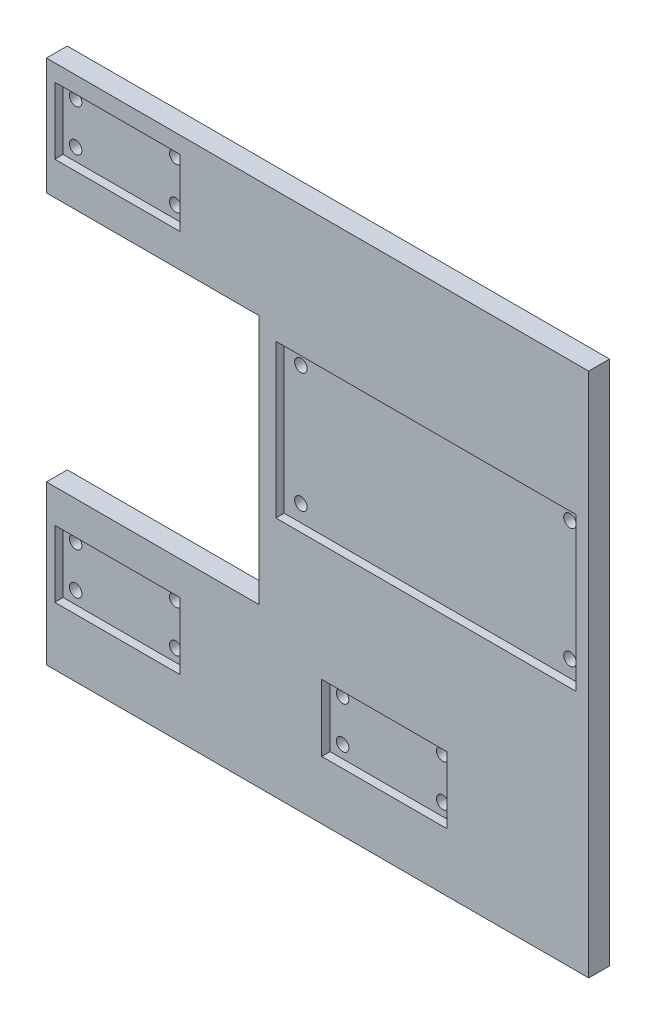
from build123d import *

# Parameters (mm, degrees)
EXTRUDE_2_DEPTH      = 5
CUT_EXTRUDE_1_DEPTH  = 2
CUT_EXTRUDE_2_REACH  = 155.704
SKETCH_4_R           = 1.55
CUT_EXTRUDE_3_REACH  = 155.756
SKETCH_5_W           = 32
SKETCH_5_H           = 56
SKETCH_7_W           = 40.5
SKETCH_7_H           = 40.5
EXTRUDE_4_DEPTH      = 2
CUT_EXTRUDE_4_DEPTH  = 2
SKETCH_9_R           = 1.55
CUT_EXTRUDE_6_DEPTH  = 154.727030805
SKETCH_10_W          = 60
SKETCH_10_H          = 45
EXTRUDE_5_DEPTH      = 2
SKETCH_11_W          = 60
SKETCH_11_H          = 45
CUT_EXTRUDE_8_DEPTH  = 2
SKETCH_12_W          = 30
SKETCH_12_H          = 16.1
SKETCH_12_W_2        = 30.5
SKETCH_12_H_2        = 16.5
EXTRUDE_6_DEPTH      = 5
SKETCH_13_R          = 1.5
CUT_EXTRUDE_10_DEPTH = 5
SKETCH_14_W          = 30
SKETCH_14_H          = 16
CUT_EXTRUDE_11_DEPTH = 2
SKETCH_15_W          = 53
SKETCH_15_H          = 60
SKETCH_15_W_2        = 49
SKETCH_15_H_2        = 56
CUT_EXTRUDE_12_DEPTH = 5
SKETCH_16_W          = 30
SKETCH_16_H          = 16
CUT_EXTRUDE_13_DEPTH = 2
SKETCH_17_R          = 1.5
CUT_EXTRUDE_15_DEPTH = 154.704261489
EXTRUDE_7_DEPTH      = 5
SKETCH_19_W          = 30
SKETCH_19_H          = 16
EXTRUDE_8_DEPTH      = 5
SKETCH_20_W          = 72
SKETCH_20_H          = 36.7
CUT_EXTRUDE_17_DEPTH = 2
SKETCH_21_R          = 1.5
CUT_EXTRUDE_18_DEPTH = 162.632298752
SKETCH_22_R          = 1.5
EXTRUDE_10_DEPTH     = 3
SKETCH_23_R          = 1.5
CUT_EXTRUDE_19_DEPTH = 162.632298752


with BuildPart() as part:
    # 草图1 → 凸台-拉伸2 (new body)
    with BuildSketch(Plane.XY):
        Polygon((0, 0), (0, 30), (120, 30), (120, -96), (0, -96), (0, -56), (45, -56), (45, 0), align=None)
    extrude(amount=EXTRUDE_2_DEPTH)

    # 草图3 → 切除-拉伸1 (cut)
    with BuildSketch(Plane.XY.offset(5)):
        Polygon((2, 10), (2, 1.95), (32, 1.95), (32, 18.05), (2, 18.05), align=None)
        Polygon((32, -74.05), (32, -57.95), (2, -57.95), (2, -66), (2, -74.05), align=None)
    extrude(amount=-CUT_EXTRUDE_1_DEPTH, mode=Mode.SUBTRACT)

    # 草图4 → 切除-拉伸2 (cut, up to next)
    with BuildSketch(Plane.XY.offset(3), mode=Mode.PRIVATE) as cut_extrude_2_sk1:
        with Locations((5, 15)):
            Circle(SKETCH_4_R)
    cut_extrude_2_tool1 = extrude(cut_extrude_2_sk1.sketch, amount=-CUT_EXTRUDE_2_REACH, mode=Mode.PRIVATE) & part.part
    # 草图4 → 切除-拉伸2 (cut, up to next)
    with BuildSketch(Plane.XY.offset(3), mode=Mode.PRIVATE) as cut_extrude_2_sk2:
        with Locations((29, 15)):
            Circle(SKETCH_4_R)
    cut_extrude_2_tool2 = extrude(cut_extrude_2_sk2.sketch, amount=-CUT_EXTRUDE_2_REACH, mode=Mode.PRIVATE) & part.part
    # 草图4 → 切除-拉伸2 (cut, up to next)
    with BuildSketch(Plane.XY.offset(3), mode=Mode.PRIVATE) as cut_extrude_2_sk3:
        with Locations((29, 5)):
            Circle(SKETCH_4_R)
    cut_extrude_2_tool3 = extrude(cut_extrude_2_sk3.sketch, amount=-CUT_EXTRUDE_2_REACH, mode=Mode.PRIVATE) & part.part
    # 草图4 → 切除-拉伸2 (cut, up to next)
    with BuildSketch(Plane.XY.offset(3), mode=Mode.PRIVATE) as cut_extrude_2_sk4:
        with Locations((5, 5)):
            Circle(SKETCH_4_R)
    cut_extrude_2_tool4 = extrude(cut_extrude_2_sk4.sketch, amount=-CUT_EXTRUDE_2_REACH, mode=Mode.PRIVATE) & part.part
    # 草图4 → 切除-拉伸2 (cut, up to next)
    with BuildSketch(Plane.XY.offset(3), mode=Mode.PRIVATE) as cut_extrude_2_sk5:
        with Locations((5, -61)):
            Circle(SKETCH_4_R)
    cut_extrude_2_tool5 = extrude(cut_extrude_2_sk5.sketch, amount=-CUT_EXTRUDE_2_REACH, mode=Mode.PRIVATE) & part.part
    # 草图4 → 切除-拉伸2 (cut, up to next)
    with BuildSketch(Plane.XY.offset(3), mode=Mode.PRIVATE) as cut_extrude_2_sk6:
        with Locations((29, -61)):
            Circle(SKETCH_4_R)
    cut_extrude_2_tool6 = extrude(cut_extrude_2_sk6.sketch, amount=-CUT_EXTRUDE_2_REACH, mode=Mode.PRIVATE) & part.part
    # 草图4 → 切除-拉伸2 (cut, up to next)
    with BuildSketch(Plane.XY.offset(3), mode=Mode.PRIVATE) as cut_extrude_2_sk7:
        with Locations((29, -71)):
            Circle(SKETCH_4_R)
    cut_extrude_2_tool7 = extrude(cut_extrude_2_sk7.sketch, amount=-CUT_EXTRUDE_2_REACH, mode=Mode.PRIVATE) & part.part
    # 草图4 → 切除-拉伸2 (cut, up to next)
    with BuildSketch(Plane.XY.offset(3), mode=Mode.PRIVATE) as cut_extrude_2_sk8:
        with Locations((5, -71)):
            Circle(SKETCH_4_R)
    cut_extrude_2_tool8 = extrude(cut_extrude_2_sk8.sketch, amount=-CUT_EXTRUDE_2_REACH, mode=Mode.PRIVATE) & part.part
    add(cut_extrude_2_tool1.solids().sort_by_distance((5, 15, 3))[0], mode=Mode.SUBTRACT)
    add(cut_extrude_2_tool2.solids().sort_by_distance((29, 15, 3))[0], mode=Mode.SUBTRACT)
    add(cut_extrude_2_tool3.solids().sort_by_distance((29, 5, 3))[0], mode=Mode.SUBTRACT)
    add(cut_extrude_2_tool4.solids().sort_by_distance((5, 5, 3))[0], mode=Mode.SUBTRACT)
    add(cut_extrude_2_tool5.solids().sort_by_distance((5, -61, 3))[0], mode=Mode.SUBTRACT)
    add(cut_extrude_2_tool6.solids().sort_by_distance((29, -61, 3))[0], mode=Mode.SUBTRACT)
    add(cut_extrude_2_tool7.solids().sort_by_distance((29, -71, 3))[0], mode=Mode.SUBTRACT)
    add(cut_extrude_2_tool8.solids().sort_by_distance((5, -71, 3))[0], mode=Mode.SUBTRACT)

    # 草图5 → 切除-拉伸3 (cut, up to next)
    with BuildSketch(Plane.XY.offset(5), mode=Mode.PRIVATE) as cut_extrude_3_sk1:
        with Locations((33, -28)):
            Rectangle(SKETCH_5_W, SKETCH_5_H)
    cut_extrude_3_tool1 = extrude(cut_extrude_3_sk1.sketch, amount=-CUT_EXTRUDE_3_REACH, mode=Mode.PRIVATE) & part.part
    add(cut_extrude_3_tool1.solids().sort_by_distance((33, -28, 5))[0], mode=Mode.SUBTRACT)

    # 草图7 → 凸台-拉伸4 (add)
    with BuildSketch(Plane.XY.offset(5)):
        with Locations((79.25, -35.75)):
            Rectangle(SKETCH_7_W, SKETCH_7_H)
    extrude(amount=EXTRUDE_4_DEPTH)

    # 草图8 → 切除-拉伸4 (cut)
    with BuildSketch(Plane.XY.offset(5)):
        Polygon((54.25, -62.25), (54.25, -78.75), (84.75, -78.75), (84.75, -62.25), (69.5, -62.25), align=None)
    extrude(amount=-CUT_EXTRUDE_4_DEPTH, mode=Mode.SUBTRACT)

    # 草图9 → 切除-拉伸6 (cut, through all)
    with BuildSketch(Plane.XY.offset(3)):
        with Locations((57.5, -65.5)):
            Circle(SKETCH_9_R)
        with Locations((81.5, -65.5)):
            Circle(SKETCH_9_R)
        with Locations((81.5, -75.5)):
            Circle(SKETCH_9_R)
        with Locations((57.5, -75.5)):
            Circle(SKETCH_9_R)
    extrude(amount=-CUT_EXTRUDE_6_DEPTH, mode=Mode.SUBTRACT)

    # 草图10 → 凸台-拉伸5 (add)
    with BuildSketch(Plane.XY.offset(7)):
        with Locations((89, -33.5)):
            Rectangle(SKETCH_10_W, SKETCH_10_H)
    extrude(amount=-EXTRUDE_5_DEPTH)

    # 草图11 → 切除-拉伸8 (cut)
    with BuildSketch(Plane.XY.offset(5)):
        with Locations((89, -33.5)):
            Rectangle(SKETCH_11_W, SKETCH_11_H)
    extrude(amount=CUT_EXTRUDE_8_DEPTH, mode=Mode.SUBTRACT)

    # 草图12 → 凸台-拉伸6 (add)
    with BuildSketch(Plane.XY.offset(5)):
        with Locations((17, 10)):
            Rectangle(SKETCH_12_W, SKETCH_12_H)
        with Locations((17, -66)):
            Rectangle(SKETCH_12_W, SKETCH_12_H)
        with Locations((69.5, -70.5)):
            Rectangle(SKETCH_12_W_2, SKETCH_12_H_2)
    extrude(amount=-EXTRUDE_6_DEPTH)

    # 草图13 → 切除-拉伸10 (cut)
    with BuildSketch(Plane.XY.offset(5)):
        with Locations((5, 23)):
            Circle(SKETCH_13_R)
        with Locations((29, 23)):
            Circle(SKETCH_13_R)
        with Locations((29, 13)):
            Circle(SKETCH_13_R)
        with Locations((5, 13)):
            Circle(SKETCH_13_R)
        with Locations((5, -69)):
            Circle(SKETCH_13_R)
        with Locations((29, -69)):
            Circle(SKETCH_13_R)
        with Locations((29, -79)):
            Circle(SKETCH_13_R)
        with Locations((5, -79)):
            Circle(SKETCH_13_R)
    extrude(amount=-CUT_EXTRUDE_10_DEPTH, mode=Mode.SUBTRACT)

    # 草图14 → 切除-拉伸11 (cut)
    with BuildSketch(Plane.XY.offset(5)):
        with Locations((17, 18)):
            Rectangle(SKETCH_14_W, SKETCH_14_H)
        with Locations((17, -74)):
            Rectangle(SKETCH_14_W, SKETCH_14_H)
    extrude(amount=-CUT_EXTRUDE_11_DEPTH, mode=Mode.SUBTRACT)

    # 草图15 → 切除-拉伸12 (cut)
    with BuildSketch(Plane.XY.offset(5)):
        with Locations((24.5, -28)):
            Rectangle(SKETCH_15_W, SKETCH_15_H)
        with Locations((24.5, -28)):
            Rectangle(SKETCH_15_W_2, SKETCH_15_H_2, mode=Mode.SUBTRACT)
    extrude(amount=-CUT_EXTRUDE_12_DEPTH, mode=Mode.SUBTRACT)

    # 草图16 → 切除-拉伸13 (cut)
    with BuildSketch(Plane.XY.offset(5)):
        with Locations((76, -74)):
            Rectangle(SKETCH_16_W, SKETCH_16_H)
    extrude(amount=-CUT_EXTRUDE_13_DEPTH, mode=Mode.SUBTRACT)

    # 草图17 → 切除-拉伸15 (cut, through all)
    with BuildSketch(Plane.XY.offset(3)):
        with Locations((64, -69)):
            Circle(SKETCH_17_R)
        with Locations((88, -69)):
            Circle(SKETCH_17_R)
        with Locations((88, -79)):
            Circle(SKETCH_17_R)
        with Locations((64, -79)):
            Circle(SKETCH_17_R)
    extrude(amount=-CUT_EXTRUDE_15_DEPTH, mode=Mode.SUBTRACT)

    # 草图18 → 凸台-拉伸7 (add)
    with BuildSketch(Plane.XY.offset(5)):
        Polygon((120, 30), (120, -46), (120, -96), (130, -96), (130, 30), align=None)
    extrude(amount=-EXTRUDE_7_DEPTH)

    # 草图19 → 凸台-拉伸8 (add)
    with BuildSketch(Plane.XY.offset(5)):
        with Locations((76, -74)):
            Rectangle(SKETCH_19_W, SKETCH_19_H)
    extrude(amount=-EXTRUDE_8_DEPTH)

    # 草图20 → 切除-拉伸17 (cut)
    with BuildSketch(Plane.XY.offset(5)):
        with Locations((91, -19.65)):
            Rectangle(SKETCH_20_W, SKETCH_20_H)
        Polygon((96, -66), (81, -66), (66, -66), (66, -74), (66, -82), (96, -82), align=None)
    extrude(amount=-CUT_EXTRUDE_17_DEPTH, mode=Mode.SUBTRACT)

    # 草图21 → 切除-拉伸18 (cut, through all)
    with BuildSketch(Plane.XY.offset(3)):
        with Locations((59, -5.3)):
            Circle(SKETCH_21_R)
        with Locations((69, -69)):
            Circle(SKETCH_21_R)
        with Locations((123, -5.3)):
            Circle(SKETCH_21_R)
        with Locations((123, -34)):
            Circle(SKETCH_21_R)
        with Locations((59, -34)):
            Circle(SKETCH_21_R)
        with Locations((93, -69)):
            Circle(SKETCH_21_R)
        with Locations((93, -79)):
            Circle(SKETCH_21_R)
        with Locations((69, -79)):
            Circle(SKETCH_21_R)
    extrude(amount=-CUT_EXTRUDE_18_DEPTH, mode=Mode.SUBTRACT)

    # 草图22 → 凸台-拉伸10 (add)
    with BuildSketch(Plane.XY.offset(3)):
        with Locations((123, -5.3)):
            Circle(SKETCH_22_R)
        with Locations((123, -34)):
            Circle(SKETCH_22_R)
    extrude(amount=-EXTRUDE_10_DEPTH)

    # 草图23 → 切除-拉伸19 (cut, through all)
    with BuildSketch(Plane.XY.offset(3)):
        with Locations((123.5, -5.3)):
            Circle(SKETCH_23_R)
        with Locations((123.5, -34)):
            Circle(SKETCH_23_R)
    extrude(amount=-CUT_EXTRUDE_19_DEPTH, mode=Mode.SUBTRACT)


solid = part.part
